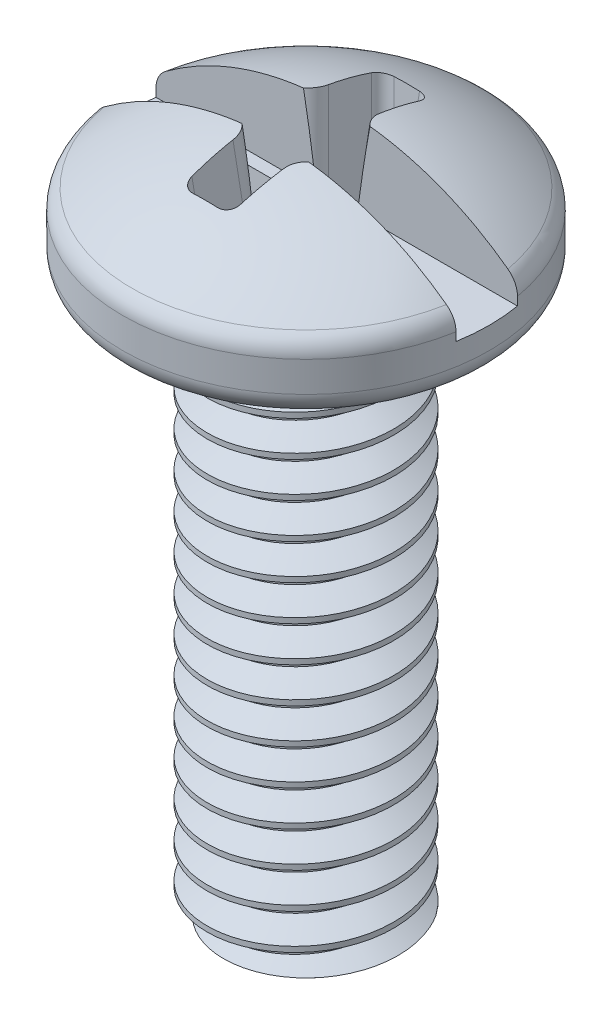
from build123d import *

# Parameters (mm, degrees)
PHILLIPS_CUT_DEPTH           = 2.54
PHILLIPS_CUT_DRAFT           = -5
PHILLIPS_CUT_FILLET_1_R      = 0.508
PHILLIPS_CUT_FILLET_2_R      = 0.254
FLATHEAD_SLOT_CUT_PROFILE_W  = 8.1788
FLATHEAD_SLOT_CUT_PROFILE_H  = 1.3716
FLATHEAD_SLOT_CUT_DEPTH      = 1.905
THREAD_SWEEP_CUT_PITCH       = 0.79375
THREAD_SWEEP_CUT_HEIGHT      = 12.5015625
THREAD_SWEEP_CUT_RADIUS      = 2.0828
THREAD_SWEEP_CUT_START_ANGLE = 90


with BuildPart() as part:
    # Body Revolve Profile → Body Revolve (revolve)
    with BuildSketch(Plane.XY, mode=Mode.PRIVATE) as body_revolve_sk:
        with BuildLine():
            Line((4.0894, -1.717050901), (4.0894, -2.39522))
            ThreePointArc((4.0894, -2.39522), (3.935402603, -2.767002603), (3.56362, -2.921))
            Line((3.56362, -2.921), (2.2098, -2.921))
            ThreePointArc((2.2098, -2.921), (2.119997439, -2.958197439), (2.0828, -3.048))
            Line((2.0828, -3.048), (2.0828, -15.087441856))
            Line((2.0828, -15.087441856), (1.3208, -15.621))
            Line((1.3208, -15.621), (0, -15.621))
            Line((0, -15.621), (0, 0))
            ThreePointArc((0, 0), (2.045424598, -0.332827184), (3.879809173, -1.296968748))
            ThreePointArc((3.879809173, -1.296968748), (4.034093459, -1.482318431), (4.0894, -1.717050901))
        make_face()
    revolve(body_revolve_sk.sketch.rotate(Axis((0, 0, 0), (0, -1, 0)), 90), axis=Axis((0, 0, 0), (0, -1, 0)))


with BuildPart() as phillips_cut_tool:
    # Phillips Cut Profile → Phillips Cut (with draft: the straight prism first)
    with BuildSketch(Plane(origin=(0, 0, 0), x_dir=(1, 0, 0), z_dir=(0, 1, 0))):
        Polygon((-0.5715, 2.286), (-0.5715, 0.5715), (-2.286, 0.5715), (-2.286, -0.5715), (-0.5715, -0.5715), (-0.5715, -2.286), (0.5715, -2.286), (0.5715, -0.5715), (2.286, -0.5715), (2.286, 0.5715), (0.5715, 0.5715), (0.5715, 2.286), align=None)
    extrude(amount=-PHILLIPS_CUT_DEPTH)
    # Phillips Cut: the draft: its side faces are tilted about the plane it starts from
    phillips_cut_sides = [phillips_cut_tool.faces().sort_by_distance(p)[0] for p in [
        (-0.5715, -1.27, -1.42875),
        (-1.42875, -1.27, -0.5715),
        (-2.286, -1.27, 0),
        (-1.42875, -1.27, 0.5715),
        (-0.5715, -1.27, 1.42875),
        (0, -1.27, 2.286),
        (0.5715, -1.27, 1.42875),
        (1.42875, -1.27, 0.5715),
        (2.286, -1.27, 0),
        (1.42875, -1.27, -0.5715),
        (0.5715, -1.27, -1.42875),
        (0, -1.27, -2.286),
    ]]
    draft(phillips_cut_sides, Plane(origin=(0, 0, 0), x_dir=(1, 0, 0), z_dir=(0, 1, 0)), PHILLIPS_CUT_DRAFT)


with BuildPart() as part_1:
    add(part.part)

    # Phillips Cut: cut by phillips_cut_tool
    add(phillips_cut_tool.part, mode=Mode.SUBTRACT)

    # Phillips Cut Fillet 1
    phillips_cut_fillet_1_edges = [part_1.edges().sort_by_distance(p)[0] for p in [
        (-0.458200153, -1.295023182, -0.458200153),
        (0.458200153, -1.295023182, -0.458200153),
        (0.458200153, -1.295023182, 0.458200153),
        (-0.458200153, -1.295023182, 0.458200153),
    ]]
    fillet(phillips_cut_fillet_1_edges, radius=PHILLIPS_CUT_FILLET_1_R)

    # Phillips Cut Fillet 2
    phillips_cut_fillet_2_edges = [part_1.edges().sort_by_distance(p)[0] for p in [
        (-0.441660444, -1.484072918, -2.156160444),
        (0.441660444, -1.484072918, -2.156160444),
        (2.156160444, -1.484072918, -0.441660444),
        (2.156160444, -1.484072918, 0.441660444),
        (0.441660444, -1.484072918, 2.156160444),
        (-0.441660444, -1.484072918, 2.156160444),
        (-2.156160444, -1.484072918, 0.441660444),
        (-2.156160444, -1.484072918, -0.441660444),
    ]]
    fillet(phillips_cut_fillet_2_edges, radius=PHILLIPS_CUT_FILLET_2_R)

    # Flathead Slot Cut Profile → Flathead Slot Cut (cut)
    with BuildSketch(Plane(origin=(0, 0, 0), x_dir=(1, 0, 0), z_dir=(0, 1, 0))):
        Rectangle(FLATHEAD_SLOT_CUT_PROFILE_W, FLATHEAD_SLOT_CUT_PROFILE_H)
    extrude(amount=-FLATHEAD_SLOT_CUT_DEPTH, mode=Mode.SUBTRACT)

    # Thread Sweep Cut: sweep along a helix
    with BuildLine() as thread_sweep_cut_path:
        add(Helix(THREAD_SWEEP_CUT_PITCH, THREAD_SWEEP_CUT_HEIGHT, THREAD_SWEEP_CUT_RADIUS, center=(0, -15.621, 0), direction=(0, 1, 0), mode=Mode.PRIVATE).rotate(Axis((0, -15.621, 0), (0, 1, 0)), THREAD_SWEEP_CUT_START_ANGLE))
    # Thread Sweep Cut Profile → Thread Sweep Cut (sweep, cut)
    with BuildSketch(Plane.XY):
        Polygon((2.2098, -15.210642258), (2.2098, -16.031357742), (1.58496, -15.6706062), (1.58496, -15.5713938), align=None)
    sweep(path=thread_sweep_cut_path.line, is_frenet=True, mode=Mode.SUBTRACT)


solid = part_1.part
